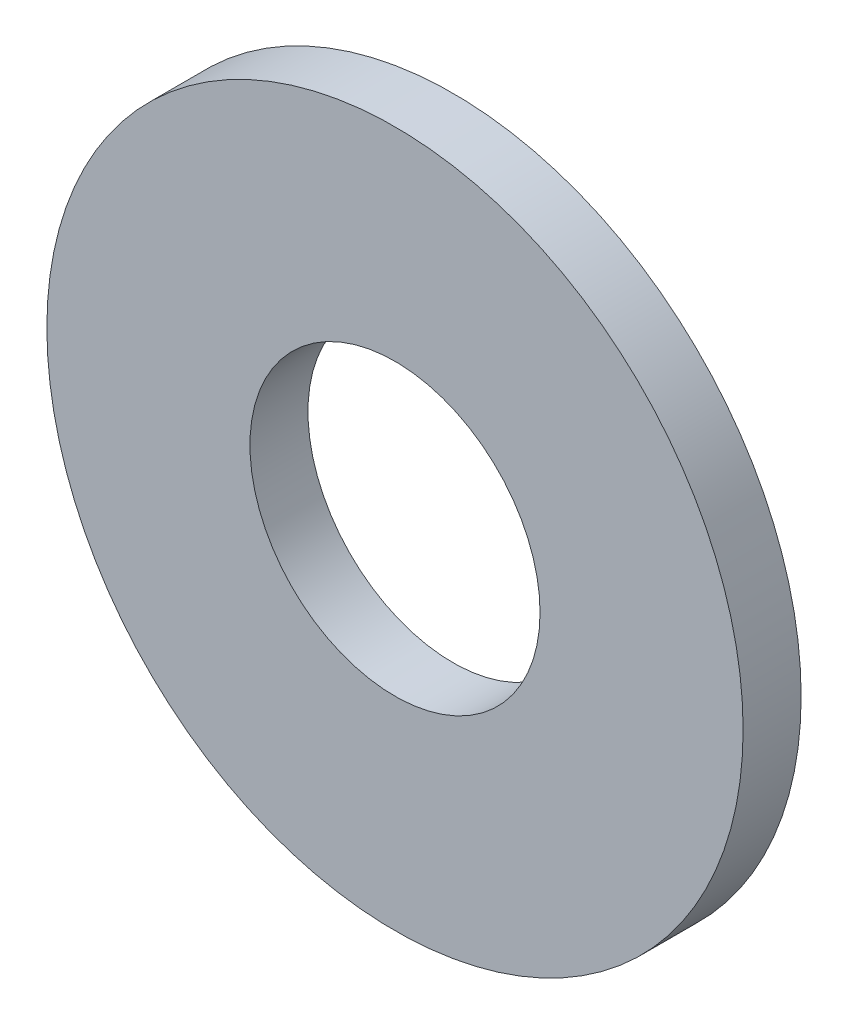
from build123d import *

# Parameters (mm, degrees)
SKETCH1_R           = 9.525
SKETCH1_R_2         = 3.96875
BOSS_EXTRUDE1_DEPTH = 1.5875


with BuildPart() as part:
    # Sketch1 → Boss-Extrude1 (new body)
    with BuildSketch(Plane.XY):
        Circle(SKETCH1_R)
        Circle(SKETCH1_R_2, mode=Mode.SUBTRACT)
    extrude(amount=-BOSS_EXTRUDE1_DEPTH)


solid = part.part
